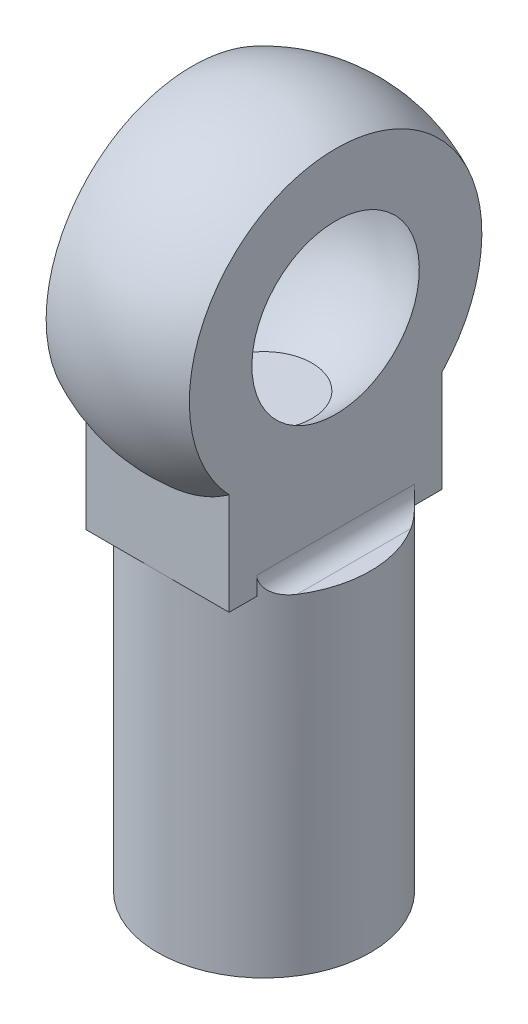
from build123d import *

# Parameters (mm, degrees)
CUT_EXTRUDE_1_DEPTH = 10
EXTRUDE_2_REACH     = 8.953
SKETCH_4_W          = 5.8
SKETCH_4_H          = 2.8
SKETCH_6_W          = 5.8
SKETCH_6_H          = 2.8
EXTRUDE_4_DEPTH     = 1.95
SKETCH_7_R          = 2.9
EXTRUDE_5_DEPTH     = 9
FILLET_1_R          = 0.5
SKETCH_8_R          = 1.5
CUT_EXTRUDE_2_DEPTH = 8


with BuildPart() as part:
    # 草图1 → 旋转1 (revolve)
    with BuildSketch(Plane.XY):
        with BuildLine():
            Line((0, 4.435), (0, -4.435))
            ThreePointArc((0, -4.435), (4.435, 0), (0, 4.435))
        make_face()
    revolve(axis=Axis((0, 4.435, 0), (0, -1, 0)))

    # 草图2 → 切除-拉伸1 (cut, symmetric)
    with BuildSketch(Plane.XY):
        Polygon((-1.95, 4.9314621), (-1.95, -5.561634077), (-9.481889981, 1.10646475), align=None)
        Polygon((1.95, 4.9314621), (1.95, -5.561634077), (8.441373461, -0.109913717), align=None)
    extrude(amount=CUT_EXTRUDE_1_DEPTH, both=True, mode=Mode.SUBTRACT)

    # 草图3 → 切除-旋转1 (revolve, cut)
    with BuildSketch(Plane.ZY):
        with BuildLine():
            Line((0, 3), (0, -3))
            ThreePointArc((0, -3), (3, 0), (0, 3))
        make_face()
    revolve(axis=Axis((0, 3, 0), (0, -1, 0)), mode=Mode.SUBTRACT)

    # 凸台-拉伸2: up to this face of the body (flat: up to its plane)
    extrude_2_end = Plane(part.part.faces().sort_by_distance((-1.95, 3.870640887, 0))[0])
    # 草图4 → 凸台-拉伸2 (add, up to the picked face)
    with BuildSketch(Plane.ZY, mode=Mode.PRIVATE) as extrude_2_sk1:
        with Locations((0, -4.1)):
            Rectangle(SKETCH_4_W, SKETCH_4_H)
    extrude_2_tool1 = split(extrude(extrude_2_sk1.sketch, amount=EXTRUDE_2_REACH, mode=Mode.PRIVATE), bisect_by=extrude_2_end, keep=Keep.BOTH, mode=Mode.PRIVATE)
    add(extrude_2_tool1.solids().sort_by(Axis((0, -4.1, 0), (-1, 0, 0)))[0])

    # 草图6 → 凸台-拉伸4 (add)
    with BuildSketch(Plane(origin=(1.95, 0, 0), x_dir=(0, 0, -1), z_dir=(1, 0, 0))):
        with Locations((0, -4.1)):
            Rectangle(SKETCH_6_W, SKETCH_6_H)
    extrude(amount=-EXTRUDE_4_DEPTH)

    # 草图7 → 凸台-拉伸5 (add)
    with BuildSketch(Plane.XZ.offset(5.5)):
        with Locations(Location((0, 0, 0), (0, 0, 132.253636979))):
            Circle(SKETCH_7_R)
    extrude(amount=EXTRUDE_5_DEPTH)

    # 圆角1
    # the kernel refuses this fillet: 0.5 mm, written as the material it adds along each edge
    with BuildSketch(Plane(origin=(-1.95, -5.5, 3.396508793), x_dir=(0, 1, 0), z_dir=(0, 0, -1))) as fillet_1_piece_1_section:
        with BuildLine():
            CenterArc((FILLET_1_R, -FILLET_1_R), FILLET_1_R, 90, 90)
            Line((0, -FILLET_1_R), (0, 0))
            Line((0, 0), (FILLET_1_R, 0))
        make_face()
    fillet_1_piece_1 = extrude(amount=6.793017587, mode=Mode.PRIVATE)
    fillet_1_piece_1 = fillet_1_piece_1 & Plane(origin=(0, -5.385657526, 0), x_dir=(-0.6724137930973646, 0, 0.7401754459939985), z_dir=(0, 1, 0)) * Cylinder(2.9, 16, mode=Mode.PRIVATE)
    add(fillet_1_piece_1)
    with BuildSketch(Plane(origin=(1.95, -5.5, -3.396508793), x_dir=(0, 1, 0), z_dir=(0, 0, 1))) as fillet_1_piece_2_section:
        with BuildLine():
            CenterArc((FILLET_1_R, -FILLET_1_R), FILLET_1_R, 90, 90)
            Line((0, -FILLET_1_R), (0, 0))
            Line((0, 0), (FILLET_1_R, 0))
        make_face()
    fillet_1_piece_2 = extrude(amount=6.793017587, mode=Mode.PRIVATE)
    fillet_1_piece_2 = fillet_1_piece_2 & Plane(origin=(0, -5.385657526, 0), x_dir=(-0.6724137930973646, 0, 0.7401754459939985), z_dir=(0, 1, 0)) * Cylinder(2.9, 16, mode=Mode.PRIVATE)
    add(fillet_1_piece_2)

    # 草图8 → 切除-拉伸2 (cut)
    with BuildSketch(Plane.XZ.offset(14.5)):
        Circle(SKETCH_8_R)
    extrude(amount=-CUT_EXTRUDE_2_DEPTH, mode=Mode.SUBTRACT)


solid = part.part
